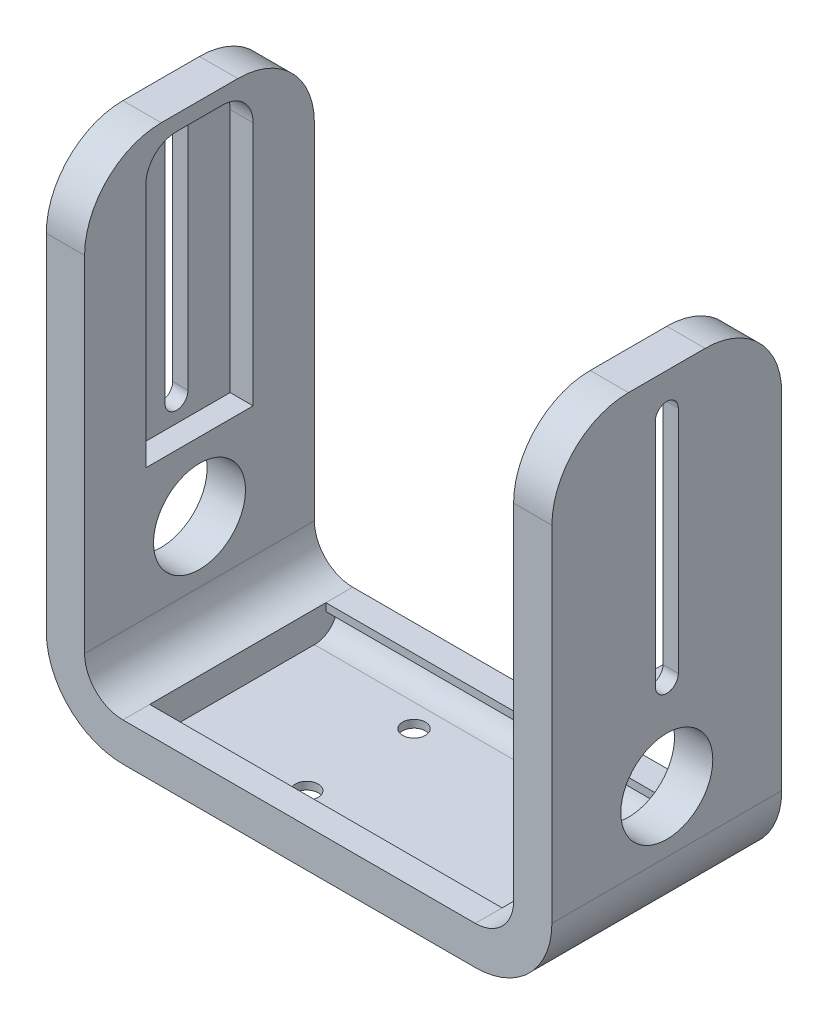
from build123d import *

# Parameters (mm, degrees)
BOSS_EXTRUDE1_DEPTH   = 15
CUT_EXTRUDE1_DEPTH    = 30
SKETCH5_W             = 14
SKETCH5_H             = 36
CUT_EXTRUDE2_DEPTH    = 3
SKETCH7_R             = 1.5
CUT_EXTRUDE3_DEPTH    = 90
MIRROR1_START         = -4
MIRROR1_DEPTH         = 9
MIRROR1_START_2       = 56
MIRROR1_2_OUTLINE_W   = 60
MIRROR1_2_OUTLINE_H   = 30
MIRROR1_2_OUTLINE_W_2 = 36
MIRROR1_2_OUTLINE_H_2 = 14
MIRROR1_2_DEPTH       = 3
MIRROR1_START_3       = 59
MIRROR1_3_OUTLINE_W   = 36
MIRROR1_3_OUTLINE_H   = 14
MIRROR1_3_DEPTH       = 2
MIRROR1_4_DEPTH       = 9
MIRROR1_START_4       = 51
MIRROR1_5_DEPTH       = 4.358898944
MIRROR1_START_5       = 22.5000001
MIRROR1_6_DEPTH       = 28.4999999
MIRROR1_START_6       = -15
MIRROR1_7_OUTLINE_W   = 2
MIRROR1_7_OUTLINE_H   = 2
MIRROR1_7_DEPTH       = 30
MIRROR1_8_OUTLINE_W   = 2
MIRROR1_8_OUTLINE_H   = 36
MIRROR1_8_DEPTH       = 8
MIRROR1_START_7       = 7
MIRROR1_9_OUTLINE_W   = 2
MIRROR1_9_OUTLINE_H   = 36
MIRROR1_9_DEPTH       = 8
MIRROR1_START_8       = -6
MIRROR1_10_OUTLINE_R  = 1.5
MIRROR1_10_DEPTH      = 3
CUT_EXTRUDE5_START    = -70
CUT_EXTRUDE5_DEPTH    = 70
BOSS_EXTRUDE2_START   = -28
BOSS_EXTRUDE2_DEPTH   = 26
FILLET1_R             = 10
FILLET2_R             = 4
FILLET3_R             = 3
SKETCH9_R             = 6
CUT_EXTRUDE6_DEPTH    = 83


with BuildPart() as part:
    # Sketch1 → Boss-Extrude1 (new, symmetric)
    with BuildSketch(Plane.XY):
        with BuildLine():
            Line((5, 0), (60, 0))
            Line((60, 0), (60, -5))
            Line((60, -5), (5, -5))
            ThreePointArc((5, -5), (-2.071067812, -2.071067812), (-5, 5))
            Line((-5, 5), (-5, 60))
            Line((-5, 60), (0, 60))
            Line((0, 60), (0, 5))
            ThreePointArc((0, 5), (1.464466094, 1.464466094), (5, 0))
        make_face()
    extrude(amount=BOSS_EXTRUDE1_DEPTH, both=True)

    # Cut-Sweep1: sweep along a path in Sketch3
    with BuildLine(Plane(origin=(0, 0, 0), x_dir=(1, 0, 0), z_dir=(0, 1, 0))) as cut_sweep1_path:
        Line((60, 0), (5, 0))
    # Sketch2 → Cut-Sweep1 (sweep, cut)
    with BuildSketch(Plane(origin=(60, 0, 0), x_dir=(0, 0, -1), z_dir=(1, 0, 0))):
        Polygon((-11.5, 0), (-11.5, -1), (-13, -1), (-13, -4), (13, -4), (13, -1), (11.5, -1), (11.5, 0), align=None)
    sweep(path=cut_sweep1_path.line, mode=Mode.SUBTRACT)

    # Sketch4 → Cut-Extrude1 (cut)
    with BuildSketch(Plane(origin=(0, 0, 0), x_dir=(0, 0, -1), z_dir=(1, 0, 0))):
        with BuildLine():
            Line((1.5, 55), (1.5, 25))
            ThreePointArc((1.5, 25), (0, 23.5), (-1.5, 25))
            Line((-1.5, 25), (-1.5, 55))
            ThreePointArc((-1.5, 55), (0, 56.5), (1.5, 55))
        make_face()
    extrude(amount=-CUT_EXTRUDE1_DEPTH, mode=Mode.SUBTRACT)

    # Sketch5 → Cut-Extrude2 (cut)
    with BuildSketch(Plane(origin=(0, 0, 0), x_dir=(0, 0, -1), z_dir=(1, 0, 0))):
        with Locations((0, 40)):
            Rectangle(SKETCH5_W, SKETCH5_H)
    extrude(amount=-CUT_EXTRUDE2_DEPTH, mode=Mode.SUBTRACT)

    # Sketch7 → Cut-Extrude3 (cut, through all)
    with BuildSketch(Plane(origin=(0, -4, 0), x_dir=(1, 0, 0), z_dir=(0, 1, 0))):
        with Locations(Location((35, 7, 0), (0, 0, 270))):
            Circle(SKETCH7_R)
        with Locations(Location((35, -7, 0), (0, 0, 270))):
            Circle(SKETCH7_R)
    extrude(amount=-CUT_EXTRUDE3_DEPTH, mode=Mode.SUBTRACT)

    # Mirror1: read off the stored shape, not the designer's step
    # Mirror1 outline → Mirror1 (cut)
    with BuildSketch(Plane.YZ.offset(MIRROR1_START)):
        Polygon((0, -11.5), (0, 11.5), (-1, 11.5), (-1, 13), (-4, 13), (-4, -13), (-1, -13), (-1, -11.5), align=None)
    extrude(amount=MIRROR1_DEPTH, mode=Mode.SUBTRACT)

    # Mirror1 2 outline → Mirror1 2 (add)
    with BuildSketch(Plane.YZ.offset(MIRROR1_START_2)):
        with Locations((30, 0)):
            Rectangle(MIRROR1_2_OUTLINE_W, MIRROR1_2_OUTLINE_H)
        with Locations((40, 0)):
            Rectangle(MIRROR1_2_OUTLINE_W_2, MIRROR1_2_OUTLINE_H_2, mode=Mode.SUBTRACT)
    extrude(amount=MIRROR1_2_DEPTH)

    # Mirror1 3 outline → Mirror1 3 (add)
    with BuildSketch(Plane.YZ.offset(MIRROR1_START_3)):
        with Locations((40, 0)):
            Rectangle(MIRROR1_3_OUTLINE_W, MIRROR1_3_OUTLINE_H)
        with BuildLine():
            Line((25, 1.5), (55, 1.5))
            ThreePointArc((55, 1.5), (56.5, 0), (55, -1.5))
            Line((55, -1.5), (25, -1.5))
            ThreePointArc((25, -1.5), (23.5, 0), (25, 1.5))
        make_face(mode=Mode.SUBTRACT)
    extrude(amount=MIRROR1_3_DEPTH)

    # Mirror1 4 outline → Mirror1 4 (add)
    with BuildSketch(Plane.YZ.offset(MIRROR1_START)):
        Polygon((-1, 11.5), (0, 11.5), (0, 15), (-5, 15), (-5, -15), (0, -15), (0, -11.5), (-1, -11.5), (-1, -13), (-4, -13), (-4, 13), (-1, 13), align=None)
    extrude(amount=MIRROR1_4_DEPTH)

    # Mirror1 5 outline → Mirror1 5 (add)
    with BuildSketch(Plane.YZ.offset(MIRROR1_START_4)):
        Polygon((0, -11.5), (0, 11.5), (-1, 11.5), (-1, 13), (-4, 13), (-4, -13), (-1, -13), (-1, -11.5), align=None)
    extrude(amount=MIRROR1_5_DEPTH)

    # Mirror1 6 outline → Mirror1 6 (add)
    with BuildSketch(Plane.YZ.offset(MIRROR1_START_5)):
        Polygon((-1, 11.5), (0, 11.5), (0, 15), (-5, 15), (-5, -15), (0, -15), (0, -11.5), (-1, -11.5), (-1, -13), (-4, -13), (-4, 13), (-1, 13), align=None)
    extrude(amount=MIRROR1_6_DEPTH)

    # Mirror1 7 outline → Mirror1 7 (add)
    with BuildSketch(Plane.XY.offset(MIRROR1_START_6)):
        with BuildLine():
            Line((56, 0), (56, 5))
            ThreePointArc((56, 5), (54.535533906, 1.464466094), (51, 0))
            Line((51, 0), (55.358898944, 0))
            Line((55.358898944, 0), (55.358898944, -4))
            ThreePointArc((55.358898944, -4), (59.473163206, -0.310885546), (61, 5))
            Line((61, 5), (61, 22))
            Line((61, 22), (59, 22))
            Line((59, 22), (59, 0))
            Line((59, 0), (56, 0))
        make_face()
        with Locations((60, 59)):
            Rectangle(MIRROR1_7_OUTLINE_W, MIRROR1_7_OUTLINE_H)
    extrude(amount=MIRROR1_7_DEPTH)

    # Mirror1 8 outline → Mirror1 8 (add)
    with BuildSketch(Plane.XY.offset(MIRROR1_START_6)):
        with Locations((60, 40)):
            Rectangle(MIRROR1_8_OUTLINE_W, MIRROR1_8_OUTLINE_H)
    extrude(amount=MIRROR1_8_DEPTH)

    # Mirror1 9 outline → Mirror1 9 (add)
    with BuildSketch(Plane.XY.offset(MIRROR1_START_7)):
        with Locations((60, 40)):
            Rectangle(MIRROR1_9_OUTLINE_W, MIRROR1_9_OUTLINE_H)
    extrude(amount=MIRROR1_9_DEPTH)

    # Mirror1 10 outline → Mirror1 10 (cut)
    with BuildSketch(Plane(origin=(0, 0, 0), x_dir=(1, 0, 0), z_dir=(0, 1, 0)).offset(MIRROR1_START_8)):
        with Locations((21, -7)):
            Circle(MIRROR1_10_OUTLINE_R)
        with Locations((21, 7)):
            Circle(MIRROR1_10_OUTLINE_R)
    extrude(amount=MIRROR1_10_DEPTH, mode=Mode.SUBTRACT)

    # Sketch8 → Cut-Extrude5 (cut)
    with BuildSketch(Plane.XY.offset(15).offset(CUT_EXTRUDE5_START)):
        with BuildLine():
            Line((65.755683461, 5), (61, 5))
            ThreePointArc((61, 5), (60.659258263, 2.411809549), (59.660254038, 0))
            Line((59.660254038, 0), (60, 0))
            Line((60, 0), (60, -5))
            Line((60, -5), (51, -5))
            Line((51, -5), (51, -9.755683461))
            ThreePointArc((51, -9.755683461), (61.433843836, -5.433843836), (65.755683461, 5))
        make_face()
        with BuildLine():
            ThreePointArc((59.660254038, 0), (56, -3.660254038), (51, -5))
            Line((51, -5), (60, -5))
            Line((60, -5), (60, 0))
            Line((60, 0), (59.660254038, 0))
        make_face()
        with BuildLine():
            Line((-4, -5), (5, -5))
            ThreePointArc((5, -5), (0, -3.660254038), (-3.660254038, 0))
            Line((-3.660254038, 0), (-4, 0))
            Line((-4, 0), (-4, -5))
        make_face()
    extrude(amount=CUT_EXTRUDE5_DEPTH, mode=Mode.SUBTRACT)

    # Sketch8<3> → Boss-Extrude2 (add)
    with BuildSketch(Plane.XY.offset(15).offset(BOSS_EXTRUDE2_START)):
        with BuildLine():
            ThreePointArc((-3.660254038, 0), (0, -3.660254038), (5, -5))
            Line((5, -5), (5, 0))
            ThreePointArc((5, 0), (1.464466094, 1.464466094), (0, 5))
            Line((0, 5), (-5, 5))
            ThreePointArc((-5, 5), (-4.659258263, 2.411809549), (-3.660254038, 0))
        make_face()
    extrude(amount=BOSS_EXTRUDE2_DEPTH)

    # Fillet1
    fillet1_edges = [part.edges().sort_by_distance(p)[0] for p in [
        (58.5, 60, -15),
        (58.5, 60, 15),
        (-2.5, 60, 15),
        (-2.5, 60, -15),
    ]]
    fillet(fillet1_edges, radius=FILLET1_R)

    # Fillet2
    fillet2_edges = [part.edges().sort_by_distance(p)[0] for p in [
        (57.5, 58, 7),
        (57.5, 58, -7),
        (-1.5, 58, 7),
        (-1.5, 58, -7),
    ]]
    fillet(fillet2_edges, radius=FILLET2_R)

    # Fillet3
    fillet3_edges = [part.edges().sort_by_distance(p)[0] for p in [
        (28, -4, 13),
        (28, -4, -13),
    ]]
    fillet(fillet3_edges, radius=FILLET3_R - 0.0001)  # a hair under: the kernel refuses the full size

    # Sketch9 → Cut-Extrude6 (cut)
    with BuildSketch(Plane.ZY.offset(5)):
        with Locations((0, 13)):
            Circle(SKETCH9_R)
    extrude(amount=-CUT_EXTRUDE6_DEPTH, mode=Mode.SUBTRACT)


solid = part.part
